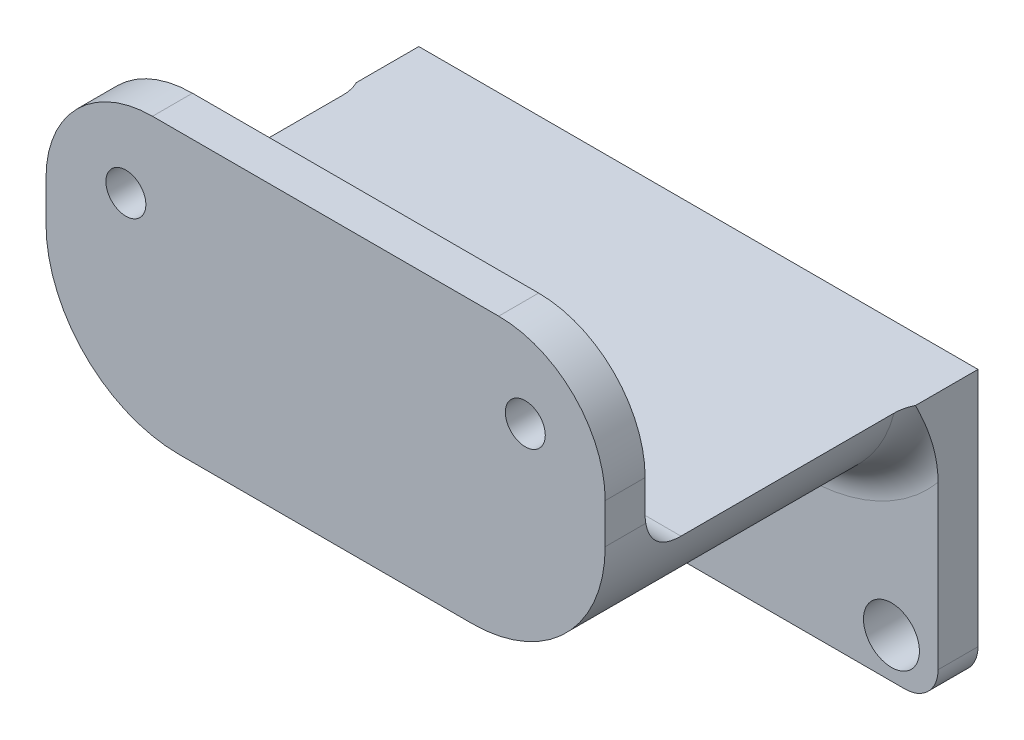
from build123d import *

# Parameters (mm, degrees)
SKETCH3_R           = 1.5000000000000042
SKETCH3_R_2         = 1.5000000000000009
BOSS_EXTRUDE3_DEPTH = 3
BOSS_EXTRUDE4_START = -25
BOSS_EXTRUDE4_DEPTH = 25
FILLET4_R           = 8
BOSS_EXTRUDE7_DEPTH = 30
FILLET6_R           = 5
FILLET7_R           = 5
SKETCH11_R          = 2.100000000000001
SKETCH11_R_2        = 2.099999999999998
CUT_EXTRUDE2_DEPTH  = 30
SKETCH12_W          = 44.28570978131377
SKETCH12_H          = 18.459325536348516
CUT_EXTRUDE3_DEPTH  = 10
FILLET8_R           = 2.5
FILLET9_R           = 3
FILLET10_R          = 3


with BuildPart() as part:
    # Sketch3 → Boss-Extrude3 (new body)
    with BuildSketch(Plane.XY):
        with BuildLine():
            Line((-22.59283479281634, 14.509357510293412), (-6.092834792816339, 14.509357510293412))
            Line((-6.092834792816339, 14.509357510293412), (-6.092834792816337, 3.5093575102934125))
            ThreePointArc((-6.092834792816337, 3.5093575102934125), (-9.021766980950868, -3.561710301572061), (-16.09283479281634, -6.490642489706586))
            Line((-16.09283479281634, -6.490642489706586), (-38.09283479281626, -6.490642489706588))
            ThreePointArc((-38.09283479281626, -6.490642489706588), (-45.16390260468181, -3.561710301572066), (-48.09283479281633, 3.5093575102934804))
            Line((-48.09283479281633, 3.5093575102934804), (-48.09283479281634, 14.509357510293412))
            Line((-48.09283479281634, 14.509357510293412), (-31.59283479281634, 14.509357510293412))
            Line((-31.59283479281634, 14.509357510293412), (-22.59283479281634, 14.509357510293412))
        make_face()
        with Locations((-42.09283479281634, 8.50935751029341)):
            Circle(SKETCH3_R, mode=Mode.SUBTRACT)
        with Locations((-12.092834792816337, 8.50935751029341)):
            Circle(SKETCH3_R_2, mode=Mode.SUBTRACT)
    extrude(amount=BOSS_EXTRUDE3_DEPTH)

    # Sketch6 → Boss-Extrude4 (add)
    with BuildSketch(Plane.XY.offset(BOSS_EXTRUDE4_START)):
        with BuildLine():
            Line((-6.401163981912088, 1.0453126866210174), (-47.78450560372057, 1.0453126866210174))
            ThreePointArc((-47.78450560372057, 1.0453126866210174), (-44.231220238651225, -4.384958427035311), (-38.09283479281626, -6.490642489706588))
            Line((-38.09283479281626, -6.490642489706588), (-16.092834792816344, -6.490642489706589))
            ThreePointArc((-16.092834792816344, -6.490642489706589), (-9.954449346981416, -4.3849584270352935), (-6.401163981912088, 1.0453126866210174))
        make_face()
    extrude(amount=BOSS_EXTRUDE4_DEPTH)

    # Fillet4
    fillet4_edges = [part.edges().sort_by_distance(p)[0] for p in [
        (-48.09283479281634, 14.509357510293412, 1.5),
        (-6.092834792816339, 14.509357510293412, 1.5),
    ]]
    fillet(fillet4_edges, radius=FILLET4_R)

    # Sketch9 → Boss-Extrude7 (add)
    with BuildSketch(Plane(origin=(0, 1.0453126866210174, 0), x_dir=(1, 0, 0), z_dir=(0, 1, 0))):
        Polygon((-6.09283479281633, 25), (-48.092834792816326, 24.999999999999996), (-48.092834792816326, 22), (-6.09283479281633, 22.000000000000007), align=None)
    extrude(amount=-BOSS_EXTRUDE7_DEPTH)

    # Fillet6
    fillet6_edges = [part.edges().sort_by_distance(p)[0] for p in [
        (-6.09283479281633, -28.954687313378983, -23.500000000000004),
    ]]
    fillet(fillet6_edges, radius=FILLET6_R)

    # Fillet7
    fillet7_edges = [part.edges().sort_by_distance(p)[0] for p in [
        (-48.092834792816326, -28.954687313378983, -23.5),
    ]]
    fillet(fillet7_edges, radius=FILLET7_R)

    # Sketch11 → Cut-Extrude2 (cut)
    with BuildSketch(Plane(origin=(0, 0, -25), x_dir=(-1, 0, 0), z_dir=(0, 0, -1))):
        with Locations((9.59283479281628, -16.490642489706588)):
            Circle(SKETCH11_R)
        with Locations((44.592834792816284, -16.490642489706588)):
            Circle(SKETCH11_R_2)
        with BuildLine():
            Line((22.592834792816276, -24.490642489706588), (31.592834792816276, -24.490642489706588))
            ThreePointArc((31.592834792816276, -24.490642489706588), (27.092834792816276, -19.990642489706588), (22.592834792816276, -24.490642489706588))
        make_face()
    extrude(amount=-CUT_EXTRUDE2_DEPTH, mode=Mode.SUBTRACT)

    # Sketch12 → Cut-Extrude3 (cut)
    with BuildSketch(Plane(origin=(0, 0, -25), x_dir=(-1, 0, 0), z_dir=(0, 0, -1))):
        with Locations((28.23568968347316, -28.720305257880845)):
            Rectangle(SKETCH12_W, SKETCH12_H)
    extrude(amount=-CUT_EXTRUDE3_DEPTH, mode=Mode.SUBTRACT)

    # Fillet8
    fillet8_edges = [part.edges().sort_by_distance(p)[0] for p in [
        (-48.092834792816326, -19.490642489706588, -23.5),
        (-6.0928347928162765, -19.490642489706588, -23.500000000000004),
    ]]
    fillet(fillet8_edges, radius=FILLET8_R)

    # Fillet9
    fillet9_edges = [part.edges().sort_by_distance(p)[0] for p in [
        (-27.09283479281633, 1.0453126866210174, 0),
    ]]
    fillet(fillet9_edges, radius=FILLET9_R)

    # Fillet10
    fillet10_edges = [part.edges().sort_by_distance(p)[0] for p in [
        (-44.23122023865123, -4.384958427035315, -22),
        (-9.954449346981423, -4.384958427035292, -22.000000000000004),
        (-27.0928347928163, -6.490642489706587, -22),
    ]]
    fillet(fillet10_edges, radius=FILLET10_R)


solid = part.part
